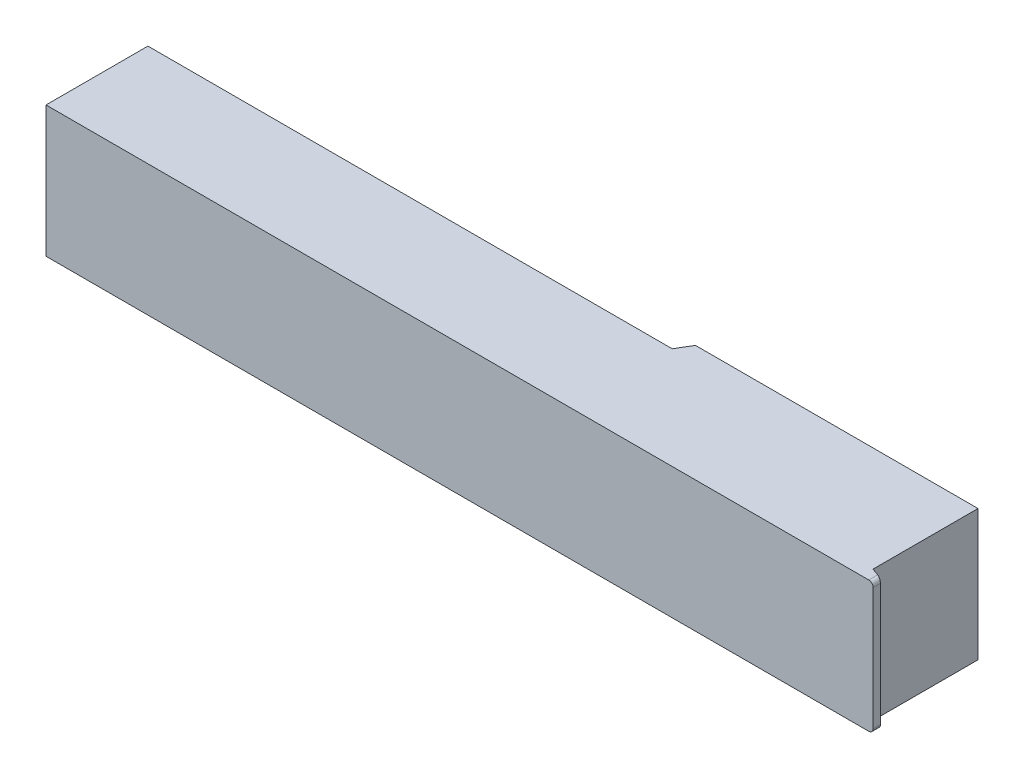
from build123d import *

# Parameters (mm, degrees)
SKETCH1_W               = 22.5
SKETCH1_H               = 142
BOSS_EXTRUDE1_DEPTH     = 20
SKETCH2_W               = 22.5
SKETCH2_H               = 18
CUT_EXTRUDE1_DEPTH      = 2
CHAMFER5_SIZE           = 2.060608065
CHAMFER5_SIZE_2         = 0.75
FILLET5_R               = 0.75
CUT_EXTRUDE4_DEPTH      = 146.155950619
CUT_EXTRUDE4_DEPTH_BACK = 146.155950619


with BuildPart() as part:
    # Sketch1 → Boss-Extrude1 (new body)
    with BuildSketch(Plane(origin=(0, 0, 0), x_dir=(0, 1, 0), z_dir=(0, 0, 1))):
        with Locations((11.25, -71)):
            Rectangle(SKETCH1_W, SKETCH1_H)
    extrude(amount=-BOSS_EXTRUDE1_DEPTH)

    # Sketch2 → Cut-Extrude1 (cut)
    with BuildSketch(Plane.YZ.offset(142)):
        with Locations((11.25, -11)):
            Rectangle(SKETCH2_W, SKETCH2_H)
    extrude(amount=-CUT_EXTRUDE1_DEPTH, mode=Mode.SUBTRACT)

    # Chamfer5
    # the kernel refuses this chamfer: 2.060608065, 0.75 mm, written as the material it takes off along each edge
    with BuildSketch(Plane(origin=(142, 27.845618587, -2), x_dir=(-0.9999130865277316, 0, -0.013184058198645886), z_dir=(0, -1, 0))) as chamfer5_piece_1_section:
        Polygon((CHAMFER5_SIZE * 0.999913086329, -CHAMFER5_SIZE * 0.013184058196), (-CHAMFER5_SIZE_2 * 0.0131840581986, -CHAMFER5_SIZE_2 * 0.999913086528), (0, 0), align=None)
    chamfer5_piece_1 = extrude(amount=33.191237174, mode=Mode.PRIVATE)
    chamfer5_piece_1 = split(chamfer5_piece_1, bisect_by=Plane(origin=(140, 11.25, -1.766801206), z_dir=(1, 0, 0)), keep=Keep.TOP, mode=Mode.PRIVATE)
    add(chamfer5_piece_1, mode=Mode.SUBTRACT)

    # Fillet5
    fillet5_edges = [part.edges().sort_by_distance(p)[0] for p in [
        (142, 0, -0.625),
        (142, 22.5, -0.625),
    ]]
    fillet(fillet5_edges, radius=FILLET5_R)

    # Sketch6 → Cut-Extrude4 (cut, two sides: drawn at the far end of the back side and taken through both)
    with BuildSketch(Plane(origin=(0, 22.5, 0), x_dir=(-1, 0, 0), z_dir=(0, 1, 0)).offset(-CUT_EXTRUDE4_DEPTH_BACK)):
        Polygon((0, -17.5), (-90, -17.5), (-91.5, -20), (-90, -20), (0, -20), align=None)
    extrude(amount=CUT_EXTRUDE4_DEPTH + CUT_EXTRUDE4_DEPTH_BACK, mode=Mode.SUBTRACT)


solid = part.part
